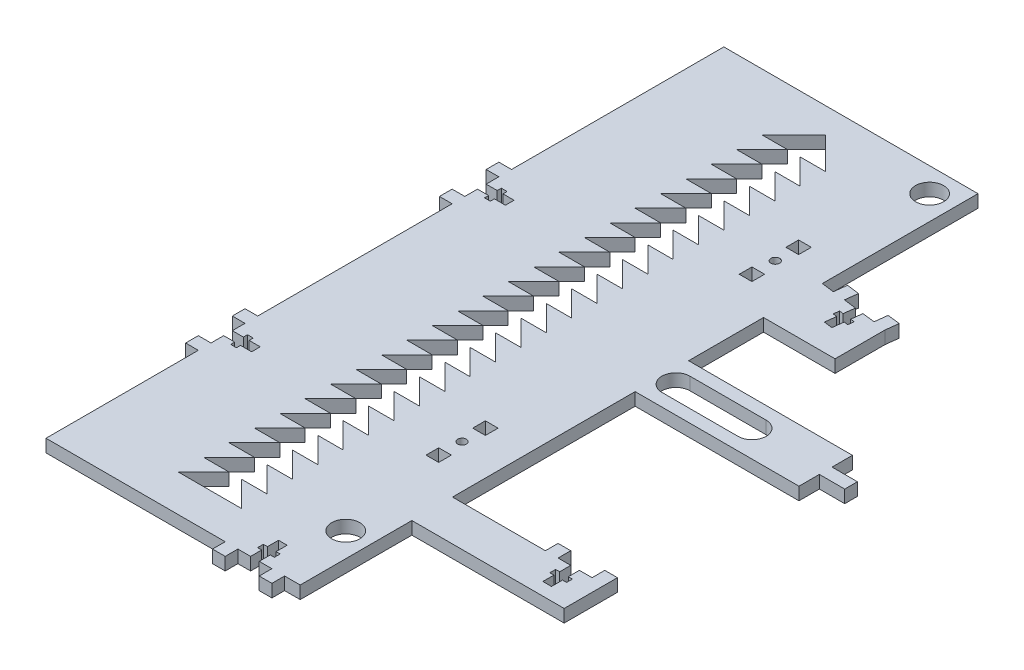
from build123d import *

# Parameters (mm, degrees)
AXLE_SUPPORT_PLATE_W   = 6.35
AXLE_SUPPORT_PLATE_H   = 6.35
AXLE_SUPPORT_PLATE_R   = 2.159
AXLE_SUPPORT_PLATE_R_2 = 7.030128061
BOSS_EXTRUDE1_DEPTH    = 6.35
BOSS_EXTRUDE2_DEPTH    = 6.35


with BuildPart() as part:
    # Axle Support Plate → Boss-Extrude1 (new body)
    with BuildSketch(Plane(origin=(0, 0, 0), x_dir=(1, 0, 0), z_dir=(0, 1, 0))):
        Polygon((55.79393597, -169.56756403), (63.58606403, -169.56756403), (63.58606403, -113.68756403), (139.78606403, -113.68756403), (139.78606403, -93.36756403), (139.78606403, -87.01756403), (133.43606403, -87.01756403), (133.43606403, -93.36756403), (127.08606403, -93.36756403), (127.08606403, -98.902564009), (129.127064012, -98.902564009), (129.127064012, -101.802564051), (127.08606403, -101.802564051), (127.08606403, -107.33756403), (122.76806403, -107.33756403), (122.76806403, -101.802564051), (120.727064048, -101.802564051), (120.727064048, -98.902564009), (122.76806403, -98.902564009), (122.76806403, -93.36756403), (116.41806403, -93.36756403), (116.41806403, -87.01756403), (110.06806403, -87.01756403), (110.06806403, -93.36756403), (63.58606403, -93.36756403), (63.58606403, -1.972692091), (145.546192091, -1.972692091), (145.546192091, 8.23243597), (158.246192091, 8.23243597), (158.246192091, 14.58243597), (145.546192091, 14.58243597), (145.546192091, 24.78756403), (63.58606403, 24.78756403), (63.58606403, 169.56756403), (-63.58606403, 169.56756403), (-63.58606403, 63.35043597), (-69.93606403, 63.35043597), (-69.93606403, 57.00043597), (-63.58606403, 57.00043597), (-63.58606403, 50.65043597), (-58.051064051, 50.65043597), (-58.051064051, 52.691435952), (-55.151064009, 52.691435952), (-55.151064009, 50.65043597), (-49.61606403, 50.65043597), (-49.61606403, 46.33243597), (-55.151064009, 46.33243597), (-55.151064009, 44.291435988), (-58.051064051, 44.291435988), (-58.051064051, 46.33243597), (-63.58606403, 46.33243597), (-63.58606403, 39.98243597), (-69.93606403, 39.98243597), (-69.93606403, 33.63243597), (-63.58606403, 33.63243597), (-63.58606403, -63.64956403), (-69.93606403, -63.64956403), (-69.93606403, -69.99956403), (-63.58606403, -69.99956403), (-63.58606403, -76.34956403), (-58.051064051, -76.34956403), (-58.051064051, -74.308564048), (-55.151064009, -74.308564048), (-55.151064009, -76.34956403), (-49.61606403, -76.34956403), (-49.61606403, -80.66756403), (-55.151064009, -80.66756403), (-55.151064009, -82.708564012), (-58.051064051, -82.708564012), (-58.051064051, -80.66756403), (-63.58606403, -80.66756403), (-63.58606403, -87.01756403), (-69.93606403, -87.01756403), (-69.93606403, -93.36756403), (-63.58606403, -93.36756403), (-63.58606403, -169.56756403), (26.07593597, -169.56756403), (26.07593597, -175.91756403), (32.42593597, -175.91756403), (32.42593597, -169.56756403), (38.77593597, -169.56756403), (38.77593597, -164.032564051), (36.734935988, -164.032564051), (36.734935988, -161.132564009), (38.77593597, -161.132564009), (38.77593597, -155.59756403), (43.09393597, -155.59756403), (43.09393597, -161.132564009), (45.134935952, -161.132564009), (45.134935952, -164.032564051), (43.09393597, -164.032564051), (43.09393597, -169.56756403), (49.44393597, -169.56756403), (49.44393597, -175.91756403), (55.79393597, -175.91756403), align=None)
        with Locations((41.95093597, -78.63556403)):
            Rectangle(AXLE_SUPPORT_PLATE_W, AXLE_SUPPORT_PLATE_H, mode=Mode.SUBTRACT)
        with Locations((41.95093597, -66.95156403)):
            Circle(AXLE_SUPPORT_PLATE_R, mode=Mode.SUBTRACT)
        with Locations((41.95093597, -55.26756403)):
            Rectangle(AXLE_SUPPORT_PLATE_W, AXLE_SUPPORT_PLATE_H, mode=Mode.SUBTRACT)
        with Locations((51.47593597, -134.64256403)):
            Circle(AXLE_SUPPORT_PLATE_R_2, mode=Mode.SUBTRACT)
        Polygon((-15.875, 140.99256403), (0, 156.86756403), (15.875, 140.99256403), (3.175, 140.99256403), (15.875, 128.29256403), (3.175, 128.29256403), (15.875, 115.59256403), (3.175, 115.59256403), (15.875, 102.89256403), (3.175, 102.89256403), (15.875, 90.19256403), (3.175, 90.19256403), (15.875, 77.49256403), (3.175, 77.49256403), (15.875, 64.79256403), (3.175, 64.79256403), (15.875, 52.09256403), (3.175, 52.09256403), (15.875, 39.39256403), (3.175, 39.39256403), (15.875, 26.69256403), (3.175, 26.69256403), (15.875, 13.99256403), (3.175, 13.99256403), (15.875, 1.29256403), (3.175, 1.29256403), (15.875, -11.40743597), (3.175, -11.40743597), (15.875, -24.10743597), (3.175, -24.10743597), (15.875, -36.80743597), (3.175, -36.80743597), (15.875, -49.50743597), (3.175, -49.50743597), (15.875, -62.20743597), (3.175, -62.20743597), (15.875, -74.90743597), (3.175, -74.90743597), (15.875, -87.60743597), (3.175, -87.60743597), (15.875, -100.30743597), (3.175, -100.30743597), (15.875, -113.00743597), (3.175, -113.00743597), (15.875, -125.70743597), (3.175, -125.70743597), (15.875, -138.40743597), (3.175, -138.40743597), (15.875, -151.10743597), (-15.875, -151.10743597), (-3.175, -138.40743597), (-15.875, -138.40743597), (-3.175, -125.70743597), (-15.875, -125.70743597), (-3.175, -113.00743597), (-15.875, -113.00743597), (-3.175, -100.30743597), (-15.875, -100.30743597), (-3.175, -87.60743597), (-15.875, -87.60743597), (-3.175, -74.90743597), (-15.875, -74.90743597), (-3.175, -62.20743597), (-15.875, -62.20743597), (-3.175, -49.50743597), (-15.875, -49.50743597), (-3.175, -36.80743597), (-15.875, -36.80743597), (-3.175, -24.10743597), (-15.875, -24.10743597), (-3.175, -11.40743597), (-15.875, -11.40743597), (-3.175, 1.29256403), (-15.875, 1.29256403), (-3.175, 13.99256403), (-15.875, 13.99256403), (-3.175, 26.69256403), (-15.875, 26.69256403), (-3.175, 39.39256403), (-15.875, 39.39256403), (-3.175, 52.09256403), (-15.875, 52.09256403), (-3.175, 64.79256403), (-15.875, 64.79256403), (-3.175, 77.49256403), (-15.875, 77.49256403), (-3.175, 90.19256403), (-15.875, 90.19256403), (-3.175, 102.89256403), (-15.875, 102.89256403), (-3.175, 115.59256403), (-15.875, 115.59256403), (-3.175, 128.29256403), (-15.875, 128.29256403), (-3.175, 140.99256403), align=None, mode=Mode.SUBTRACT)
        with Locations((41.95093597, 78.08243597)):
            Rectangle(AXLE_SUPPORT_PLATE_W, AXLE_SUPPORT_PLATE_H, mode=Mode.SUBTRACT)
        with Locations((41.95093597, 89.76643597)):
            Circle(AXLE_SUPPORT_PLATE_R, mode=Mode.SUBTRACT)
        with Locations((41.95093597, 101.45043597)):
            Rectangle(AXLE_SUPPORT_PLATE_W, AXLE_SUPPORT_PLATE_H, mode=Mode.SUBTRACT)
        with BuildLine():
            ThreePointArc((70.616192091, 4.377307909), (63.58606403, 11.40743597), (70.616192091, 18.43756403))
            Line((70.616192091, 18.43756403), (108.716192091, 18.43756403))
            ThreePointArc((108.716192091, 18.43756403), (115.746320151, 11.40743597), (108.716192091, 4.377307909))
            Line((108.716192091, 4.377307909), (70.616192091, 4.377307909))
        make_face(mode=Mode.SUBTRACT)
        with Locations((51.47593597, 157.45743597)):
            Circle(AXLE_SUPPORT_PLATE_R_2, mode=Mode.SUBTRACT)
    extrude(amount=BOSS_EXTRUDE1_DEPTH)

    # Sketch1 → Boss-Extrude2 (add)
    with BuildSketch(Plane(origin=(0, 6.35, 0), x_dir=(1, 0, 0), z_dir=(0, 1, 0))):
        Polygon((99.385218628, 62.256573995), (99.385218628, 87.274703072), (100.159088958, 93.577371135), (93.856420895, 94.351241465), (93.082550565, 88.048573402), (86.779882502, 88.822443733), (86.105335689, 83.328700804), (88.131122366, 83.079965477), (87.777701265, 80.201581595), (85.751914588, 80.450316923), (85.077367774, 74.956573995), (80.791553492, 75.482805819), (81.466100305, 80.976548748), (79.440313627, 81.225284076), (79.793734728, 84.103667957), (81.819521406, 83.854932629), (82.494068219, 89.348675558), (76.191400156, 90.122545888), (76.965270487, 96.425213951), (70.662602424, 97.199084282), (69.888732093, 90.896416219), (63.58606403, 91.67028655), (63.58606403, 62.256573995), align=None)
    extrude(amount=-BOSS_EXTRUDE2_DEPTH)


solid = part.part
